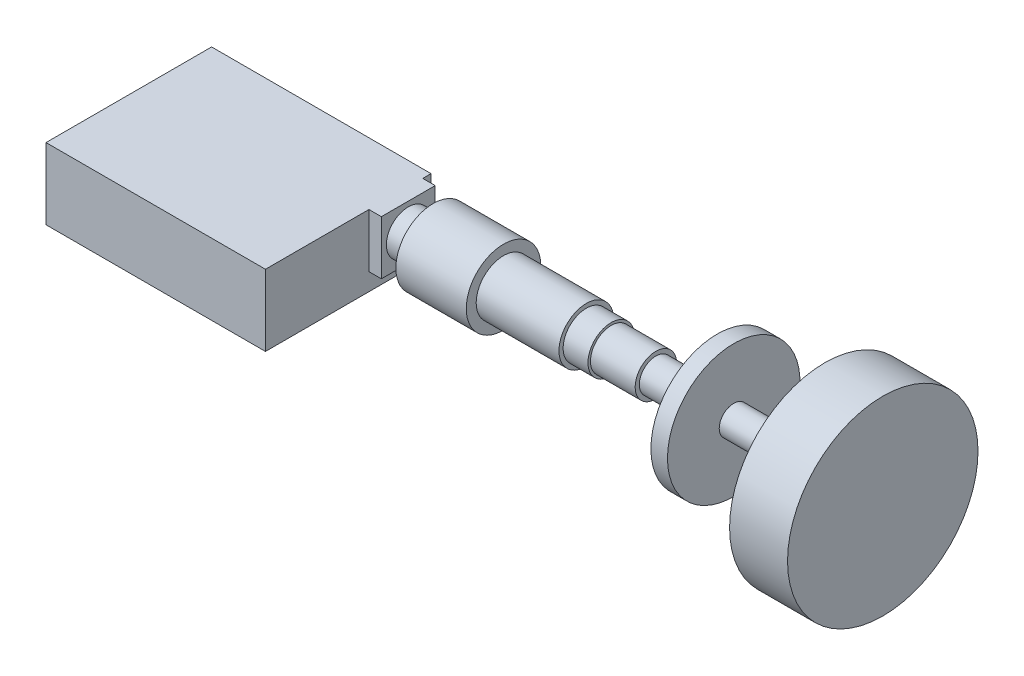
from build123d import *

# Parameters (mm, degrees)
SKETCH1_W           = 26.5
SKETCH1_H           = 20
BOSS_EXTRUDE1_DEPTH = 8.6
SKETCH2_W           = 6.5
SKETCH2_H           = 6.5
BOSS_EXTRUDE2_DEPTH = 1.5


with BuildPart() as part:
    # Sketch1 → Boss-Extrude1 (new body)
    with BuildSketch(Plane(origin=(0, 0, 0), x_dir=(1, 0, 0), z_dir=(0, 1, 0))):
        Rectangle(SKETCH1_W, SKETCH1_H)
    extrude(amount=BOSS_EXTRUDE1_DEPTH)

    # Sketch2 → Boss-Extrude2 (add)
    with BuildSketch(Plane(origin=(13.25, 0, 0), x_dir=(0, 0, -1), z_dir=(1, 0, 0))):
        with Locations((5.75, 5.35)):
            Rectangle(SKETCH2_W, SKETCH2_H)
    extrude(amount=BOSS_EXTRUDE2_DEPTH)

    # Sketch6 → Revolve1 (revolve)
    with BuildSketch(Plane.XY.offset(-5.75)):
        Polygon((14.75, 5.35), (14.75, 2.7), (17.75, 2.7), (17.75, 0.85), (26.25, 0.85), (26.25, 2.05), (36.25, 2.05), (36.25, 2.55), (39.25, 2.55), (39.25, 2.85), (44.65, 2.85), (44.65, 3.35), (52.05, 3.35), (52.05, -2.65), (54.05, -2.65), (54.05, 3.6), (65.05, 3.6), (65.05, -6.15), (72.05, -6.15), (72.05, 5.35), align=None)
    revolve(axis=Axis((14.75, 5.35, -5.75), (1, 0, 0)))


solid = part.part
